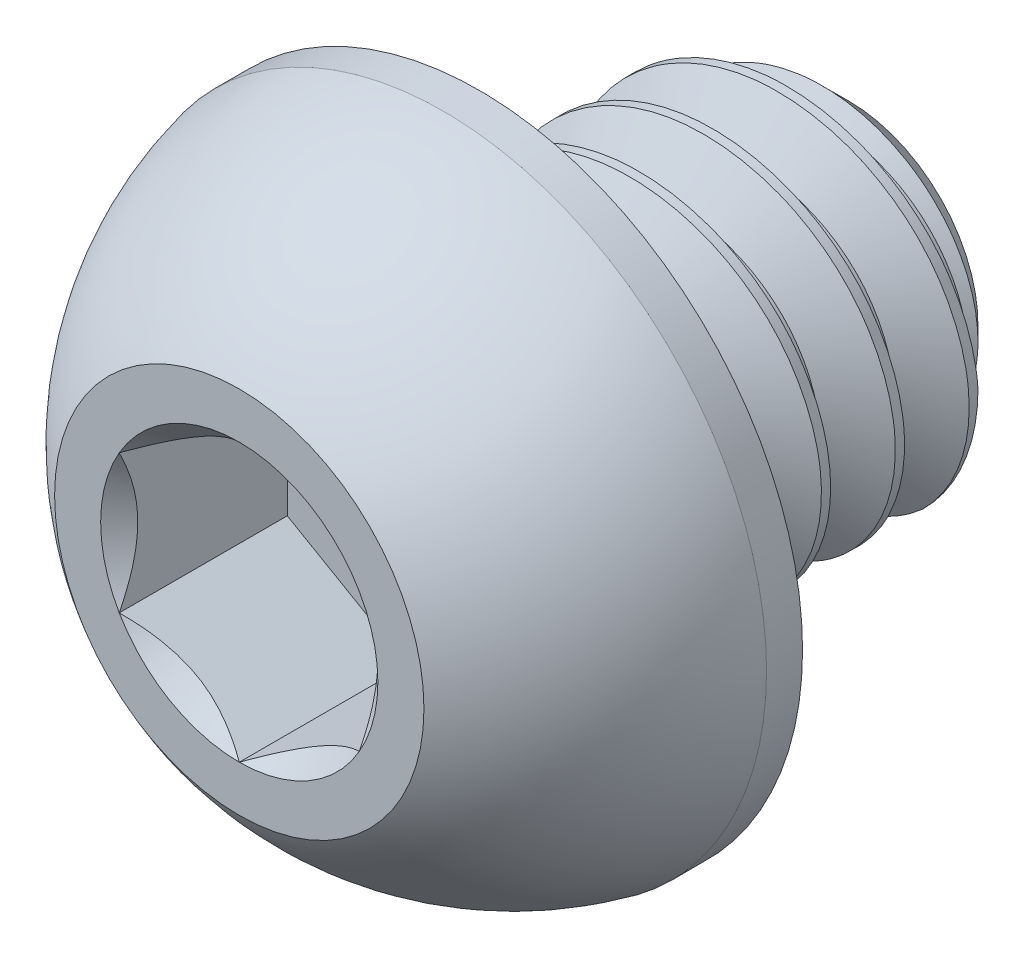
from build123d import *

# Parameters (mm, degrees)
SKETCH1_W          = 2
SKETCH1_H          = 1
CHAMFER1_SIZE      = 0.3
CUT_SWEEP1_PITCH   = 0.4
CUT_EXTRUDE2_DEPTH = 0.91


with BuildPart() as part:
    # Sketch1 → Revolve1 (revolve)
    with BuildSketch(Plane(origin=(0, 0, 0), x_dir=(0, 0, -1), z_dir=(1, 0, 0))):
        with Locations((2.3, 0.5)):
            Rectangle(SKETCH1_W, SKETCH1_H)
    revolve(axis=Axis((0, 0, -3.3), (0, 0, 1)))

    # Chamfer1
    chamfer1_edges = [part.edges().sort_by_distance(p)[0] for p in [
        (0, -1, -3.3),
    ]]
    chamfer(chamfer1_edges, length=CHAMFER1_SIZE)

    # Cut-Sweep1: the profile of Sketch2 profile screwed along a right-hand helix of 6 turns, 6 arcs to a turn; built about Z, then put on its axis
    cut_sweep1_z = Axis((0, 0, 0), (0, 0, 1))
    cut_sweep1_corners = [(1.0003, 0, 0.000173205), (1.0003, 0, -0.350173205), (0.740192379, 0, -0.2), (0.740192379, 0, -0.15)]
    with BuildLine(mode=Mode.PRIVATE) as cut_sweep1_profile:
        Line(cut_sweep1_corners[0], cut_sweep1_corners[1])
        Line(cut_sweep1_corners[1], cut_sweep1_corners[2])
        Line(cut_sweep1_corners[2], cut_sweep1_corners[3])
        Line(cut_sweep1_corners[3], cut_sweep1_corners[0])
    cut_sweep1_cap = Face(cut_sweep1_profile.wire())
    cut_sweep1_turn_angles = [0, 30, 60, 90, 120, 150, 180, 210, 240, 270, 300, 330, 360]
    cut_sweep1_turn_weights = [1, 0.8660254037844387, 1, 0.8660254037844387, 1, 0.8660254037844387, 1, 0.8660254037844387, 1, 0.8660254037844387, 1, 0.8660254037844387, 1]
    cut_sweep1_turn_rails = [Edge.make_bspline([Vector(p[0], p[1], 0).rotate(cut_sweep1_z, cut_sweep1_turn_angles[k]) / cut_sweep1_turn_weights[k] + Vector(0, 0, p[2] + CUT_SWEEP1_PITCH * cut_sweep1_turn_angles[k] / 360) for k in range(13)], [0, 0, 0, 1, 1, 2, 2, 3, 3, 4, 4, 5, 5, 6, 6, 6], 2, cut_sweep1_turn_weights) for p in cut_sweep1_corners]
    cut_sweep1_turn_sides = [Face.make_surface_from_curves(cut_sweep1_turn_rails[p[0]], cut_sweep1_turn_rails[p[1]]) for p in [(0, 1), (1, 2), (2, 3), (3, 0)]]
    cut_sweep1 = Plane(origin=(0, 0, -3.3), x_dir=(0, 1, 0), z_dir=(0, 0, 1)) * Solid(Shell([*[p.moved(Location((0, 0, CUT_SWEEP1_PITCH * i))) for i in range(6) for p in cut_sweep1_turn_sides], cut_sweep1_cap, cut_sweep1_cap.rotate(cut_sweep1_z, 2160).moved(Location((0, 0, CUT_SWEEP1_PITCH * 2160 / 360)))]))
    add(cut_sweep1, mode=Mode.SUBTRACT)

    # Sketch7 → Revolve2 (revolve)
    with BuildSketch(Plane(origin=(0, 0, 0), x_dir=(0, 0, -1), z_dir=(1, 0, 0)), mode=Mode.PRIVATE) as revolve2_sk:
        with BuildLine():
            Line((1.105, 1.75), (1.3, 1.75))
            Line((1.3, 1.75), (1.3, 0))
            Line((1.3, 0), (0, 0))
            Line((0, 0), (0, 1))
            ThreePointArc((0, 1), (0.479976957, 1.481850617), (1.105, 1.75))
        make_face()
    revolve(revolve2_sk.sketch.rotate(Axis((0, 0, 0), (0, 0, -1)), 189.336081704), axis=Axis((0, 0, 0), (0, 0, -1)))

    # Sketch5 → Cut-Extrude2 (cut)
    with BuildSketch(Plane.XY):
        Polygon((0.65, -0.375277675), (0.65, 0.375277675), (0, 0.75055535), (-0.65, 0.375277675), (-0.65, -0.375277675), (0, -0.75055535), align=None)
    extrude(amount=-CUT_EXTRUDE2_DEPTH, mode=Mode.SUBTRACT)

    # Cut-Extrude3 cone 1 section (through the dimple's axis) → Cut-Extrude3 (revolve, cut)
    with BuildSketch(Plane(origin=(0, 0, 0), x_dir=(0, -1, 0), z_dir=(1, 0, 0))):
        Polygon((0, 0), (0.75055535, 0), (0, 0.75055535), align=None)
    revolve(axis=Axis((0, 0, 0), (0, 0, -1)), mode=Mode.SUBTRACT)


solid = part.part
